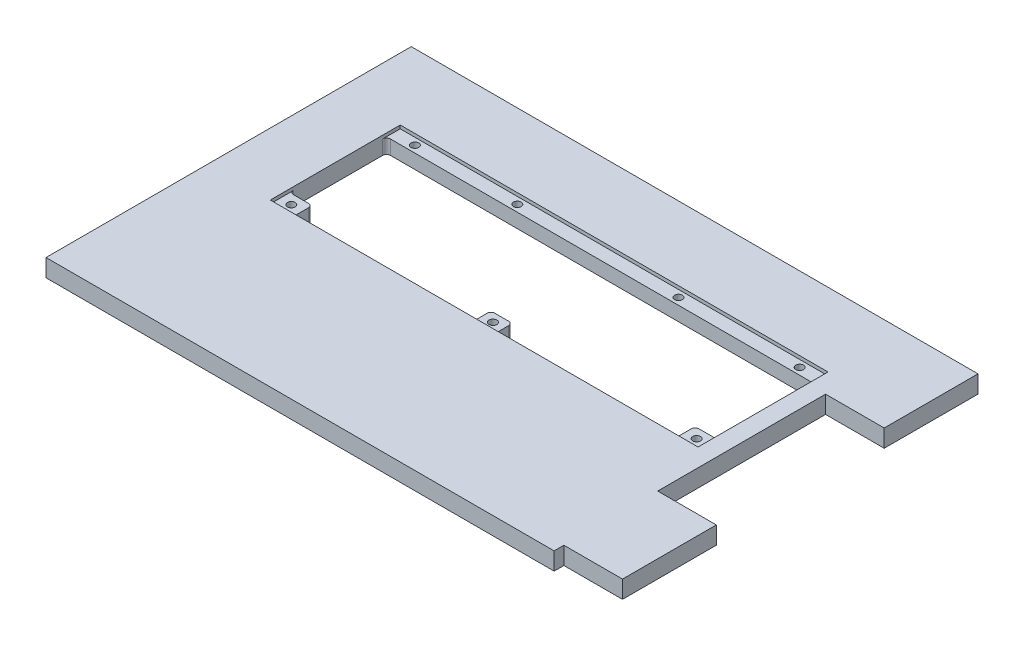
from build123d import *

# Parameters (mm, degrees)
SKETCH1_W           = 260
SKETCH1_H           = 186.9
BOSS_EXTRUDE1_DEPTH = 9
SKETCH2_W           = 218.9
SKETCH2_H           = 66.5
CUT_EXTRUDE1_DEPTH  = 9
SKETCH4_W           = 218.9
SKETCH4_H           = 7
SKETCH4_W_2         = 11.5
SKETCH4_H_2         = 10
SKETCH4_W_3         = 11
SKETCH4_H_3         = 9
BOSS_EXTRUDE2_DEPTH = 7.3
SKETCH3_R           = 2
CUT_EXTRUDE2_DEPTH  = 6.6
FILLET1_R           = 2
SKETCH5_W           = 48
SKETCH5_H           = 9
BOSS_EXTRUDE3_DEPTH = 30


with BuildPart() as part:
    # Sketch1 → Boss-Extrude1 (new body)
    with BuildSketch(Plane(origin=(0, 0, 0), x_dir=(1, 0, 0), z_dir=(0, 1, 0))):
        with Locations((115, 93.45)):
            Rectangle(SKETCH1_W, SKETCH1_H)
    extrude(amount=BOSS_EXTRUDE1_DEPTH)

    # Sketch2 → Cut-Extrude1 (cut)
    with BuildSketch(Plane(origin=(0, 0, 0), x_dir=(1, 0, 0), z_dir=(0, 1, 0))):
        with Locations((126.36, 116.1)):
            Rectangle(SKETCH2_W, SKETCH2_H)
    extrude(amount=CUT_EXTRUDE1_DEPTH, mode=Mode.SUBTRACT)

    # Sketch4 → Boss-Extrude2 (add)
    with BuildSketch(Plane(origin=(0, 0, 0), x_dir=(1, 0, 0), z_dir=(0, 1, 0))):
        with Locations((126.36, 145.85)):
            Rectangle(SKETCH4_W, SKETCH4_H)
        with Locations((230.06, 87.85)):
            Rectangle(SKETCH4_W_2, SKETCH4_H_2)
        with Locations((126.36, 87.35)):
            Rectangle(SKETCH4_W_3, SKETCH4_H_3)
        with Locations((22.66, 87.85)):
            Rectangle(SKETCH4_W_2, SKETCH4_H_2)
    extrude(amount=BOSS_EXTRUDE2_DEPTH)

    # Sketch3 → Cut-Extrude2 (cut)
    with BuildSketch(Plane(origin=(0, 9, 0), x_dir=(1, 0, 0), z_dir=(0, 1, 0))):
        with Locations((27.91, 145.85)):
            Circle(SKETCH3_R)
        with Locations((80.31, 145.85)):
            Circle(SKETCH3_R)
        with Locations((162.81, 145.85)):
            Circle(SKETCH3_R)
        with Locations((224.81, 145.85)):
            Circle(SKETCH3_R)
        with Locations((22.66, 87.85)):
            Circle(SKETCH3_R)
        with Locations((126.36, 87.35)):
            Circle(SKETCH3_R)
        with Locations((230.06, 87.85)):
            Circle(SKETCH3_R)
    extrude(amount=-CUT_EXTRUDE2_DEPTH, mode=Mode.SUBTRACT)

    # Fillet1
    fillet1_edges = [part.edges().sort_by_distance(p)[0] for p in [
        (16.91, 3.65, -92.85),
        (28.41, 3.65, -82.85),
        (28.41, 3.65, -92.85),
        (16.91, 3.65, -142.35),
        (235.81, 3.65, -142.35),
        (235.81, 3.65, -92.85),
        (224.31, 3.65, -82.85),
        (224.31, 3.65, -92.85),
        (120.86, 3.65, -82.85),
        (131.86, 3.65, -82.85),
        (131.86, 3.65, -91.85),
        (120.86, 3.65, -91.85),
    ]]
    fillet(fillet1_edges, radius=FILLET1_R)

    # Sketch5 → Boss-Extrude3 (add)
    with BuildSketch(Plane(origin=(245, 0, 0), x_dir=(0, 0, -1), z_dir=(1, 0, 0))):
        with Locations((29, 4.5)):
            Rectangle(SKETCH5_W, SKETCH5_H)
        with Locations((162.9, 4.5)):
            Rectangle(SKETCH5_W, SKETCH5_H)
    extrude(amount=BOSS_EXTRUDE3_DEPTH)


solid = part.part
